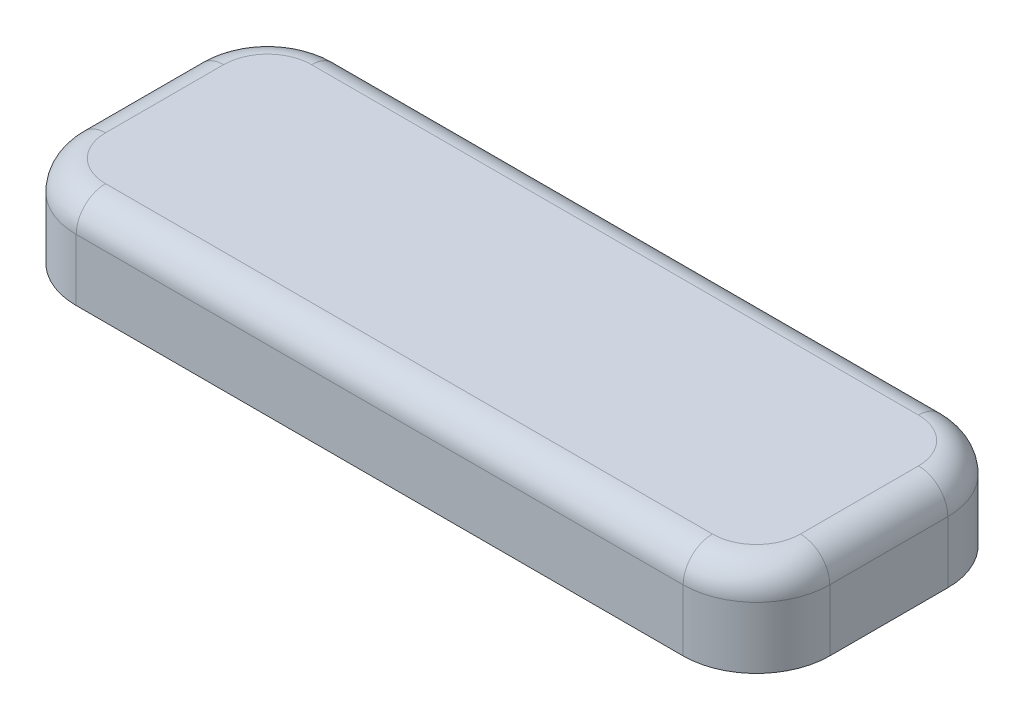
from build123d import *

# Parameters (mm, degrees)
SKETCH_1_R      = 2.8
EXTRUDE_1_DEPTH = 5
SKETCH_2_W      = 51.3875
SKETCH_2_H      = 18.05
EXTRUDE_2_DEPTH = 1.2
SKETCH_3_W      = 51.3875
SKETCH_3_H      = 18.05
SKETCH_3_W_2    = 48.9875
SKETCH_3_H_2    = 15.65
EXTRUDE_3_DEPTH = 5
FILLET_1_R      = 5
FILLET_2_R      = 2
SKETCH_1_3_R    = 2.8
EXTRUDE_4_DEPTH = 5
SKETCH_1_4_R    = 2.8
EXTRUDE_5_DEPTH = 5
CHAMFER_3_SIZE  = 0.5


with BuildPart() as part:
    # 草图1 → 凸台-拉伸1 (new body)
    with BuildSketch(Plane(origin=(0, 0, 0), x_dir=(1, 0, 0), z_dir=(0, 1, 0))):
        Circle(SKETCH_1_R)
        Polygon((2.2, 0.6), (2.2, -0.6), (0.6, -0.6), (0.6, -2.2), (-0.6, -2.2), (-0.6, -0.6), (-2.2, -0.6), (-2.2, 0.6), (-0.6, 0.6), (-0.6, 2.2), (0.6, 2.2), (0.6, 0.6), align=None, mode=Mode.SUBTRACT)
    extrude(amount=-EXTRUDE_1_DEPTH)

    # 草图2 → 凸台-拉伸2 (add)
    with BuildSketch(Plane(origin=(0, 0, 0), x_dir=(1, 0, 0), z_dir=(0, 1, 0))):
        Rectangle(SKETCH_2_W, SKETCH_2_H)
    extrude(amount=EXTRUDE_2_DEPTH)

    # 草图3 → 凸台-拉伸3 (add)
    with BuildSketch(Plane(origin=(0, 0, 0), x_dir=(1, 0, 0), z_dir=(0, 1, 0))):
        Rectangle(SKETCH_3_W, SKETCH_3_H)
        Rectangle(SKETCH_3_W_2, SKETCH_3_H_2, mode=Mode.SUBTRACT)
    extrude(amount=-EXTRUDE_3_DEPTH)

    # 圆角1
    fillet_1_edges = [part.edges().sort_by_distance(p)[0] for p in [
        (-25.69375, -1.9, -9.025),
        (25.69375, -1.9, -9.025),
        (25.69375, -1.9, 9.025),
        (-25.69375, -1.9, 9.025),
        (-24.49375, -2.5, -7.825),
        (24.49375, -2.5, -7.825),
        (24.49375, -2.5, 7.825),
        (-24.49375, -2.5, 7.825),
    ]]
    fillet(fillet_1_edges, radius=FILLET_1_R)

    # 圆角2
    fillet_2_edges = [part.edges().sort_by_distance(p)[0] for p in [
        (24.49375, 0, 0),
        (0, 0, 7.825),
        (0, 0, -7.825),
        (-24.49375, 0, 0),
        (24.229283906, 1.2, -7.560533906),
        (25.69375, 1.2, 0),
        (24.229283906, 1.2, 7.560533906),
        (0, 1.2, 9.025),
        (-24.229283906, 1.2, 7.560533906),
        (-25.69375, 1.2, 0),
        (-24.229283906, 1.2, -7.560533906),
        (0, 1.2, -9.025),
        (23.029283906, 0, 6.360533906),
        (23.029283906, 0, -6.360533906),
        (-23.029283906, 0, -6.360533906),
        (-23.029283906, 0, 6.360533906),
    ]]
    fillet(fillet_2_edges, radius=FILLET_2_R)

    # 草图1<3> → 凸台-拉伸4 (add)
    with BuildSketch(Plane(origin=(0, 0, 0), x_dir=(1, 0, 0), z_dir=(0, 1, 0))):
        with Locations((11.90625, 0)):
            Circle(SKETCH_1_3_R)
        Polygon((9.70625, 0.6), (9.70625, -0.6), (11.30625, -0.6), (11.30625, -2.2), (12.50625, -2.2), (12.50625, -0.6), (14.10625, -0.6), (14.10625, 0.6), (12.50625, 0.6), (12.50625, 2.2), (11.30625, 2.2), (11.30625, 0.6), align=None, mode=Mode.SUBTRACT)
    extrude(amount=-EXTRUDE_4_DEPTH)

    # 草图1<4> → 凸台-拉伸5 (add)
    with BuildSketch(Plane(origin=(0, 0, 0), x_dir=(1, 0, 0), z_dir=(0, 1, 0))):
        with Locations((-11.90625, 0)):
            Circle(SKETCH_1_4_R)
        Polygon((-14.10625, -0.6), (-14.10625, 0.6), (-12.50625, 0.6), (-12.50625, 2.2), (-11.30625, 2.2), (-11.30625, 0.6), (-9.70625, 0.6), (-9.70625, -0.6), (-11.30625, -0.6), (-11.30625, -2.2), (-12.50625, -2.2), (-12.50625, -0.6), align=None, mode=Mode.SUBTRACT)
    extrude(amount=-EXTRUDE_5_DEPTH)

    # 倒角3
    chamfer_3_edges = [part.edges().sort_by_distance(p)[0] for p in [
        (-14.70625, 0, 0),
        (-2.8, 0, 0),
        (9.10625, 0, 0),
    ]]
    chamfer(chamfer_3_edges, length=CHAMFER_3_SIZE)


solid = part.part
